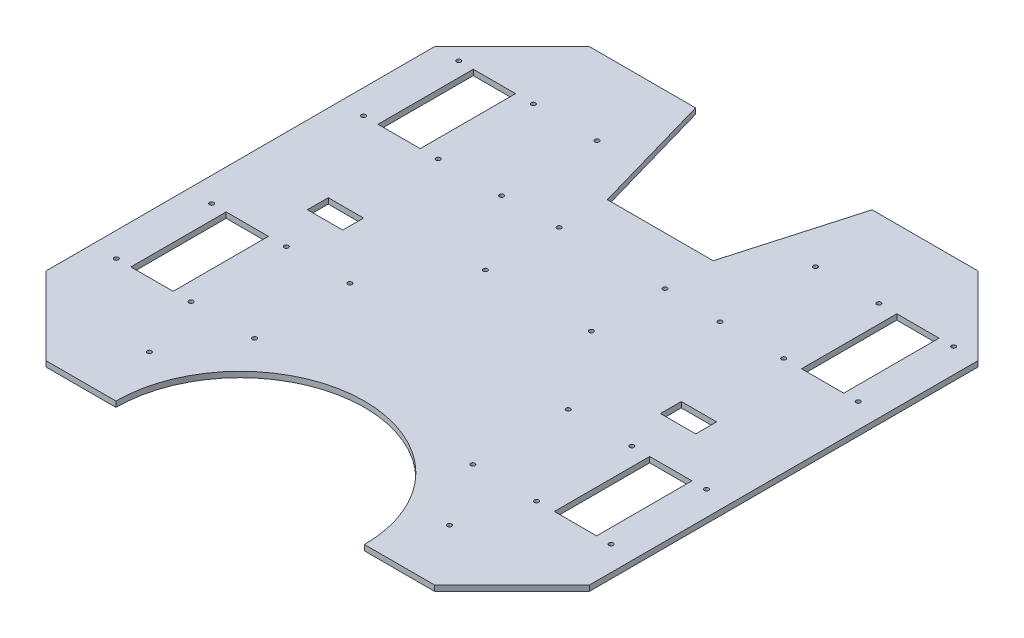
from build123d import *

# Parameters (mm, degrees)
SKETCH_1_R      = 1.55
SKETCH_1_W      = 30.4
SKETCH_1_H      = 68.58
SKETCH_1_W_2    = 25.4
SKETCH_1_H_2    = 15
EXTRUDE_1_DEPTH = 4


with BuildPart() as part:
    # 草图1 → 凸台-拉伸1 (new body)
    with BuildSketch(Plane(origin=(0, 0, 0), x_dir=(1, 0, 0), z_dir=(0, 1, 0))):
        with BuildLine():
            Line((-212.783006705, -92.69108054), (-212.783006705, 186.70891946))
            Line((-212.783006705, 186.70891946), (-156.903006705, 242.58891946))
            Line((-156.903006705, 242.58891946), (-80.703006705, 242.58891946))
            Line((-80.703006705, 242.58891946), (-55.303006705, 153.68891946))
            Line((-55.303006705, 153.68891946), (20.896993295, 153.68891946))
            Line((20.896993295, 153.68891946), (46.296993295, 242.58891946))
            Line((46.296993295, 242.58891946), (122.496993295, 242.58891946))
            Line((122.496993295, 242.58891946), (178.376993295, 186.70891946))
            Line((178.376993295, 186.70891946), (178.376993295, -92.69108054))
            Line((178.376993295, -92.69108054), (122.496993295, -148.57108054))
            Line((122.496993295, -148.57108054), (72.204993295, -148.57108054))
            ThreePointArc((72.204993295, -148.57108054), (-17.203006705, -59.16308054), (-106.611006705, -148.57108054))
            Line((-106.611006705, -148.57108054), (-156.903006705, -148.57108054))
            Line((-156.903006705, -148.57108054), (-212.783006705, -92.69108054))
        make_face()
        with Locations((-141.489006705, 186.70891946)):
            Circle(SKETCH_1_R, mode=Mode.SUBTRACT)
        with Locations((20.896993295, 66.00891946)):
            Circle(SKETCH_1_R, mode=Mode.SUBTRACT)
        with Locations((90.746993295, -105.99108054)):
            Circle(SKETCH_1_R, mode=Mode.SUBTRACT)
        with Locations((-125.153006705, -105.99108054)):
            Circle(SKETCH_1_R, mode=Mode.SUBTRACT)
        with Locations((-141.489006705, 118.12891946)):
            Circle(SKETCH_1_R, mode=Mode.SUBTRACT)
        with Locations((-95.769006705, 118.12891946)):
            Circle(SKETCH_1_R, mode=Mode.SUBTRACT)
        with Locations((107.082993295, 118.12891946)):
            Circle(SKETCH_1_R, mode=Mode.SUBTRACT)
        with Locations((-141.489006705, 8.90891946)):
            Circle(SKETCH_1_R, mode=Mode.SUBTRACT)
        with Locations((61.362993295, 118.12891946)):
            Circle(SKETCH_1_R, mode=Mode.SUBTRACT)
        with Locations((61.362993295, 186.70891946)):
            Circle(SKETCH_1_R, mode=Mode.SUBTRACT)
        with Locations((-141.489006705, -59.67108054)):
            Circle(SKETCH_1_R, mode=Mode.SUBTRACT)
        with Locations((-95.769006705, -59.67108054)):
            Circle(SKETCH_1_R, mode=Mode.SUBTRACT)
        with Locations((-95.769006705, 186.70891946)):
            Circle(SKETCH_1_R, mode=Mode.SUBTRACT)
        with Locations((107.082993295, -59.67108054)):
            Circle(SKETCH_1_R, mode=Mode.SUBTRACT)
        with Locations((61.362993295, -59.67108054)):
            Circle(SKETCH_1_R, mode=Mode.SUBTRACT)
        with Locations((107.082993295, 186.70891946)):
            Circle(SKETCH_1_R, mode=Mode.SUBTRACT)
        with Locations((160.796993295, 186.70891946)):
            Circle(SKETCH_1_R, mode=Mode.SUBTRACT)
        with Locations((-195.203006705, 118.12891946)):
            Circle(SKETCH_1_R, mode=Mode.SUBTRACT)
        with Locations((-195.203006705, 186.70891946)):
            Circle(SKETCH_1_R, mode=Mode.SUBTRACT)
        with Locations((160.796993295, 8.90891946)):
            Circle(SKETCH_1_R, mode=Mode.SUBTRACT)
        with Locations((-55.303006705, 66.00891946)):
            Circle(SKETCH_1_R, mode=Mode.SUBTRACT)
        with Locations((20.896993295, 119.00891946)):
            Circle(SKETCH_1_R, mode=Mode.SUBTRACT)
        with Locations((-55.303006705, 119.00891946)):
            Circle(SKETCH_1_R, mode=Mode.SUBTRACT)
        with Locations((160.796993295, 118.12891946)):
            Circle(SKETCH_1_R, mode=Mode.SUBTRACT)
        with Locations((107.082993295, 8.90891946)):
            Circle(SKETCH_1_R, mode=Mode.SUBTRACT)
        with Locations((61.362993295, 8.90891946)):
            Circle(SKETCH_1_R, mode=Mode.SUBTRACT)
        with Locations((-95.769006705, 8.90891946)):
            Circle(SKETCH_1_R, mode=Mode.SUBTRACT)
        with Locations((-195.203006705, 8.90891946)):
            Circle(SKETCH_1_R, mode=Mode.SUBTRACT)
        with Locations((-195.203006705, -59.67108054)):
            Circle(SKETCH_1_R, mode=Mode.SUBTRACT)
        with Locations((160.796993295, -59.67108054)):
            Circle(SKETCH_1_R, mode=Mode.SUBTRACT)
        with Locations((-169.563006705, -25.38108054)):
            Rectangle(SKETCH_1_W, SKETCH_1_H, mode=Mode.SUBTRACT)
        with Locations((135.156993295, 152.41891946)):
            Rectangle(SKETCH_1_W, SKETCH_1_H, mode=Mode.SUBTRACT)
        with Locations((135.156993295, -25.38108054)):
            Rectangle(SKETCH_1_W, SKETCH_1_H, mode=Mode.SUBTRACT)
        with Locations((-169.563006705, 152.41891946)):
            Rectangle(SKETCH_1_W, SKETCH_1_H, mode=Mode.SUBTRACT)
        with Locations((-144.203006705, 47.00891946)):
            Rectangle(SKETCH_1_W_2, SKETCH_1_H_2, mode=Mode.SUBTRACT)
        with Locations((109.796993295, 47.00891946)):
            Rectangle(SKETCH_1_W_2, SKETCH_1_H_2, mode=Mode.SUBTRACT)
    extrude(amount=EXTRUDE_1_DEPTH)


solid = part.part
